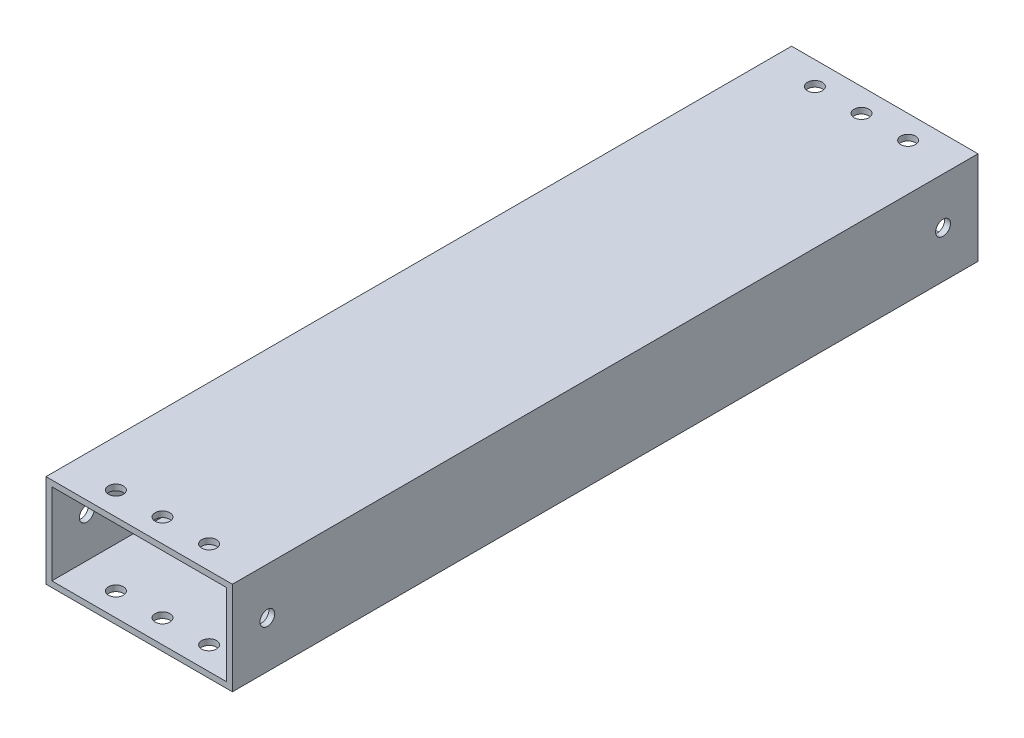
from build123d import *

# Parameters (mm, degrees)
SKETCH1_W           = 50.8
SKETCH1_H           = 25.4
SKETCH1_W_2         = 47.625
SKETCH1_H_2         = 22.225
BOSS_EXTRUDE1_DEPTH = 101.6
SKETCH2_R           = 2.0193
CUT_EXTRUDE1_DEPTH  = 115.3
SKETCH3_R           = 2.0193
CUT_EXTRUDE2_DEPTH  = 108.763073453


with BuildPart() as part:
    # Sketch1 → Boss-Extrude1 (new, symmetric)
    with BuildSketch(Plane.XY):
        Rectangle(SKETCH1_W, SKETCH1_H)
        Rectangle(SKETCH1_W_2, SKETCH1_H_2, mode=Mode.SUBTRACT)
    extrude(amount=BOSS_EXTRUDE1_DEPTH, both=True)

    # Sketch2 → Cut-Extrude1 (cut, through all)
    with BuildSketch(Plane(origin=(25.4, 0, 0), x_dir=(0, 0, -1), z_dir=(1, 0, 0))):
        with Locations((-92.075, 0)):
            Circle(SKETCH2_R)
        with Locations((92.075, 0)):
            Circle(SKETCH2_R)
    extrude(amount=-CUT_EXTRUDE1_DEPTH, mode=Mode.SUBTRACT)

    # Sketch3 → Cut-Extrude2 (cut, through all)
    with BuildSketch(Plane(origin=(0, 12.7, 0), x_dir=(1, 0, 0), z_dir=(0, 1, 0))):
        with Locations((-12.7, -95.25)):
            Circle(SKETCH3_R)
        with Locations((0, -95.25)):
            Circle(SKETCH3_R)
        with Locations((12.7, -95.25)):
            Circle(SKETCH3_R)
        with Locations((12.7, 95.25)):
            Circle(SKETCH3_R)
        with Locations((0, 95.25)):
            Circle(SKETCH3_R)
        with Locations((-12.7, 95.25)):
            Circle(SKETCH3_R)
    extrude(amount=-CUT_EXTRUDE2_DEPTH, mode=Mode.SUBTRACT)


solid = part.part
